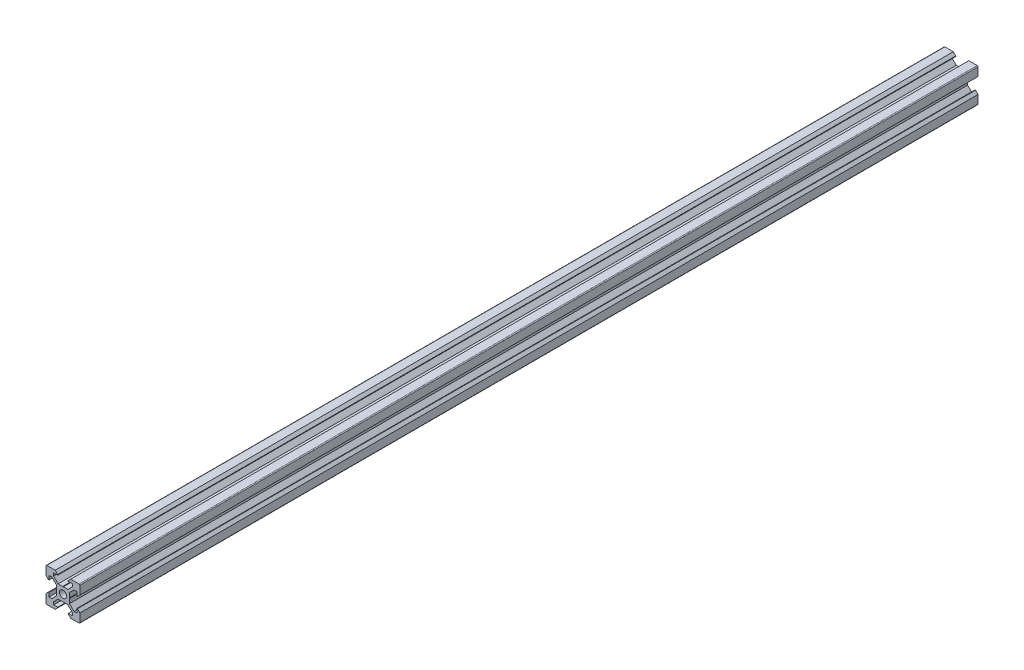
from build123d import *

# Parameters (mm, degrees)
V_SLOT_START                           = -39.785851387
V_SLOT_20X20X500_LINEAR_RAIL_OUTLINE_R = 2.1
V_SLOT_20X20X500_LINEAR_RAIL_DEPTH     = 500
BOSS_EXTRUDE1_START                    = 30
SKETCH1_R                              = 2.1
BOSS_EXTRUDE1_DEPTH                    = 30


# Read off the part's stored shape, not the designer's step: V-Slot 20x20x500 Linear Rail
with BuildPart() as part:
    # V-Slot 20x20x500 Linear Rail outline → V-Slot 20x20x500 Linear Rail (new body)
    with BuildSketch(Plane.XY.offset(V_SLOT_START)):
        with BuildLine():
            Line((30.148857471, 35.33441708), (30.148857471, 37.963756908))
            Line((30.148857471, 37.963756908), (29.938857471, 38.173756908))
            Line((29.938857471, 38.173756908), (30.148857471, 38.383756908))
            Line((30.148857471, 38.383756908), (30.148857471, 41.013096736))
            Line((30.148857471, 41.013096736), (32.809517643, 43.673756908))
            Line((32.809517643, 43.673756908), (34.448857471, 43.673756908))
            Line((34.448857471, 43.673756908), (34.448857471, 41.298756908))
            Line((34.448857471, 41.298756908), (34.793857471, 41.298756908))
            Line((34.793857471, 41.298756908), (36.248857471, 42.753756908))
            Line((36.248857471, 42.753756908), (36.248857471, 47.673756908))
            ThreePointArc((36.248857471, 47.673756908), (36.102410862, 48.027310299), (35.748857471, 48.173756908))
            Line((35.748857471, 48.173756908), (30.828857471, 48.173756908))
            Line((30.828857471, 48.173756908), (29.373857471, 46.718756908))
            Line((29.373857471, 46.718756908), (29.373857471, 46.373756908))
            Line((29.373857471, 46.373756908), (31.748857471, 46.373756908))
            Line((31.748857471, 46.373756908), (31.748857471, 44.73441708))
            Line((31.748857471, 44.73441708), (29.0881973, 42.073756908))
            Line((29.0881973, 42.073756908), (26.458857471, 42.073756908))
            Line((26.458857471, 42.073756908), (26.248857471, 41.863756908))
            Line((26.248857471, 41.863756908), (26.038857471, 42.073756908))
            Line((26.038857471, 42.073756908), (23.409517643, 42.073756908))
            Line((23.409517643, 42.073756908), (20.748857471, 44.73441708))
            Line((20.748857471, 44.73441708), (20.748857471, 46.373756908))
            Line((20.748857471, 46.373756908), (23.123857471, 46.373756908))
            Line((23.123857471, 46.373756908), (23.123857471, 46.718756908))
            Line((23.123857471, 46.718756908), (21.668857471, 48.173756908))
            Line((21.668857471, 48.173756908), (16.748857471, 48.173756908))
            ThreePointArc((16.748857471, 48.173756908), (16.395304081, 48.027310298), (16.248857471, 47.673756908))
            Line((16.248857471, 47.673756908), (16.248857471, 42.753756908))
            Line((16.248857471, 42.753756908), (17.703857471, 41.298756908))
            Line((17.703857471, 41.298756908), (18.048857471, 41.298756908))
            Line((18.048857471, 41.298756908), (18.048857471, 43.673756908))
            Line((18.048857471, 43.673756908), (19.6881973, 43.673756908))
            Line((19.6881973, 43.673756908), (22.348857471, 41.013096736))
            Line((22.348857471, 41.013096736), (22.348857471, 38.383756908))
            Line((22.348857471, 38.383756908), (22.558857471, 38.173756908))
            Line((22.558857471, 38.173756908), (22.348857471, 37.963756908))
            Line((22.348857471, 37.963756908), (22.348857471, 35.33441708))
            Line((22.348857471, 35.33441708), (19.6881973, 32.673756908))
            Line((19.6881973, 32.673756908), (18.048857471, 32.673756908))
            Line((18.048857471, 32.673756908), (18.048857471, 35.048756908))
            Line((18.048857471, 35.048756908), (17.703857471, 35.048756908))
            Line((17.703857471, 35.048756908), (16.248857471, 33.593756908))
            Line((16.248857471, 33.593756908), (16.248857471, 28.673756908))
            ThreePointArc((16.248857471, 28.673756908), (16.395304081, 28.320203518), (16.748857471, 28.173756908))
            Line((16.748857471, 28.173756908), (21.668857471, 28.173756908))
            Line((21.668857471, 28.173756908), (23.123857471, 29.628756908))
            Line((23.123857471, 29.628756908), (23.123857471, 29.973756908))
            Line((23.123857471, 29.973756908), (20.748857471, 29.973756908))
            Line((20.748857471, 29.973756908), (20.748857471, 31.613096736))
            Line((20.748857471, 31.613096736), (23.409517643, 34.273756908))
            Line((23.409517643, 34.273756908), (26.038857471, 34.273756908))
            Line((26.038857471, 34.273756908), (26.248857471, 34.483756908))
            Line((26.248857471, 34.483756908), (26.458857471, 34.273756908))
            Line((26.458857471, 34.273756908), (29.0881973, 34.273756908))
            Line((29.0881973, 34.273756908), (31.748857471, 31.613096736))
            Line((31.748857471, 31.613096736), (31.748857471, 29.973756908))
            Line((31.748857471, 29.973756908), (29.373857471, 29.973756908))
            Line((29.373857471, 29.973756908), (29.373857471, 29.628756908))
            Line((29.373857471, 29.628756908), (30.828857471, 28.173756908))
            Line((30.828857471, 28.173756908), (35.748857471, 28.173756908))
            ThreePointArc((35.748857471, 28.173756908), (36.102410862, 28.320203518), (36.248857471, 28.673756908))
            Line((36.248857471, 28.673756908), (36.248857471, 33.593756908))
            Line((36.248857471, 33.593756908), (34.793857471, 35.048756908))
            Line((34.793857471, 35.048756908), (34.448857471, 35.048756908))
            Line((34.448857471, 35.048756908), (34.448857471, 32.673756908))
            Line((34.448857471, 32.673756908), (32.809517643, 32.673756908))
            Line((32.809517643, 32.673756908), (30.148857471, 35.33441708))
        make_face()
        with Locations((26.248857471, 38.173756908)):
            Circle(V_SLOT_20X20X500_LINEAR_RAIL_OUTLINE_R, mode=Mode.SUBTRACT)
    extrude(amount=V_SLOT_20X20X500_LINEAR_RAIL_DEPTH)

    # Sketch1 → Boss-Extrude1 (add)
    with BuildSketch(Plane(origin=(0, 0, -39.785851387), x_dir=(-1, 0, 0), z_dir=(0, 0, -1)).offset(BOSS_EXTRUDE1_START)):
        with BuildLine():
            Line((-29.938857471, 38.173756908), (-30.148857471, 37.963756908))
            Line((-30.148857471, 37.963756908), (-30.148857471, 35.33441708))
            Line((-30.148857471, 35.33441708), (-32.809517643, 32.673756908))
            Line((-32.809517643, 32.673756908), (-34.448857471, 32.673756908))
            Line((-34.448857471, 32.673756908), (-34.448857471, 35.048756908))
            Line((-34.448857471, 35.048756908), (-34.793857471, 35.048756908))
            Line((-34.793857471, 35.048756908), (-36.248857471, 33.593756908))
            Line((-36.248857471, 33.593756908), (-36.248857471, 28.673756908))
            ThreePointArc((-36.248857471, 28.673756908), (-36.102410862, 28.320203518), (-35.748857471, 28.173756908))
            Line((-35.748857471, 28.173756908), (-30.828857471, 28.173756908))
            Line((-30.828857471, 28.173756908), (-29.373857471, 29.628756908))
            Line((-29.373857471, 29.628756908), (-29.373857471, 29.973756908))
            Line((-29.373857471, 29.973756908), (-31.748857471, 29.973756908))
            Line((-31.748857471, 29.973756908), (-31.748857471, 31.613096736))
            Line((-31.748857471, 31.613096736), (-29.0881973, 34.273756908))
            Line((-29.0881973, 34.273756908), (-26.458857471, 34.273756908))
            Line((-26.458857471, 34.273756908), (-26.248857471, 34.483756908))
            Line((-26.248857471, 34.483756908), (-26.038857471, 34.273756908))
            Line((-26.038857471, 34.273756908), (-23.409517643, 34.273756908))
            Line((-23.409517643, 34.273756908), (-20.748857471, 31.613096736))
            Line((-20.748857471, 31.613096736), (-20.748857471, 29.973756908))
            Line((-20.748857471, 29.973756908), (-23.123857471, 29.973756908))
            Line((-23.123857471, 29.973756908), (-23.123857471, 29.628756908))
            Line((-23.123857471, 29.628756908), (-21.668857471, 28.173756908))
            Line((-21.668857471, 28.173756908), (-16.748857471, 28.173756908))
            ThreePointArc((-16.748857471, 28.173756908), (-16.395304081, 28.320203518), (-16.248857471, 28.673756908))
            Line((-16.248857471, 28.673756908), (-16.248857471, 33.593756908))
            Line((-16.248857471, 33.593756908), (-17.703857471, 35.048756908))
            Line((-17.703857471, 35.048756908), (-18.048857471, 35.048756908))
            Line((-18.048857471, 35.048756908), (-18.048857471, 32.673756908))
            Line((-18.048857471, 32.673756908), (-19.6881973, 32.673756908))
            Line((-19.6881973, 32.673756908), (-22.348857471, 35.33441708))
            Line((-22.348857471, 35.33441708), (-22.348857471, 37.963756908))
            Line((-22.348857471, 37.963756908), (-22.558857471, 38.173756908))
            Line((-22.558857471, 38.173756908), (-22.348857471, 38.383756908))
            Line((-22.348857471, 38.383756908), (-22.348857471, 41.013096736))
            Line((-22.348857471, 41.013096736), (-19.6881973, 43.673756908))
            Line((-19.6881973, 43.673756908), (-18.048857471, 43.673756908))
            Line((-18.048857471, 43.673756908), (-18.048857471, 41.298756908))
            Line((-18.048857471, 41.298756908), (-17.703857471, 41.298756908))
            Line((-17.703857471, 41.298756908), (-16.248857471, 42.753756908))
            Line((-16.248857471, 42.753756908), (-16.248857471, 47.673756908))
            ThreePointArc((-16.248857471, 47.673756908), (-16.395304081, 48.027310299), (-16.748857471, 48.173756908))
            Line((-16.748857471, 48.173756908), (-21.668857471, 48.173756908))
            Line((-21.668857471, 48.173756908), (-23.123857471, 46.718756908))
            Line((-23.123857471, 46.718756908), (-23.123857471, 46.373756908))
            Line((-23.123857471, 46.373756908), (-20.748857471, 46.373756908))
            Line((-20.748857471, 46.373756908), (-20.748857471, 44.73441708))
            Line((-20.748857471, 44.73441708), (-23.409517643, 42.073756908))
            Line((-23.409517643, 42.073756908), (-26.038857471, 42.073756908))
            Line((-26.038857471, 42.073756908), (-26.248857471, 41.863756908))
            Line((-26.248857471, 41.863756908), (-26.458857471, 42.073756908))
            Line((-26.458857471, 42.073756908), (-29.0881973, 42.073756908))
            Line((-29.0881973, 42.073756908), (-31.748857471, 44.73441708))
            Line((-31.748857471, 44.73441708), (-31.748857471, 46.373756908))
            Line((-31.748857471, 46.373756908), (-29.373857471, 46.373756908))
            Line((-29.373857471, 46.373756908), (-29.373857471, 46.718756908))
            Line((-29.373857471, 46.718756908), (-30.828857471, 48.173756908))
            Line((-30.828857471, 48.173756908), (-35.748857471, 48.173756908))
            ThreePointArc((-35.748857471, 48.173756908), (-36.102410862, 48.027310299), (-36.248857471, 47.673756908))
            Line((-36.248857471, 47.673756908), (-36.248857471, 42.753756908))
            Line((-36.248857471, 42.753756908), (-34.793857471, 41.298756908))
            Line((-34.793857471, 41.298756908), (-34.448857471, 41.298756908))
            Line((-34.448857471, 41.298756908), (-34.448857471, 43.673756908))
            Line((-34.448857471, 43.673756908), (-32.809517643, 43.673756908))
            Line((-32.809517643, 43.673756908), (-30.148857471, 41.013096736))
            Line((-30.148857471, 41.013096736), (-30.148857471, 38.383756908))
            Line((-30.148857471, 38.383756908), (-29.938857471, 38.173756908))
        make_face()
        with Locations((-26.248857471, 38.173756908)):
            Circle(SKETCH1_R, mode=Mode.SUBTRACT)
    extrude(amount=-BOSS_EXTRUDE1_DEPTH)


solid = part.part
